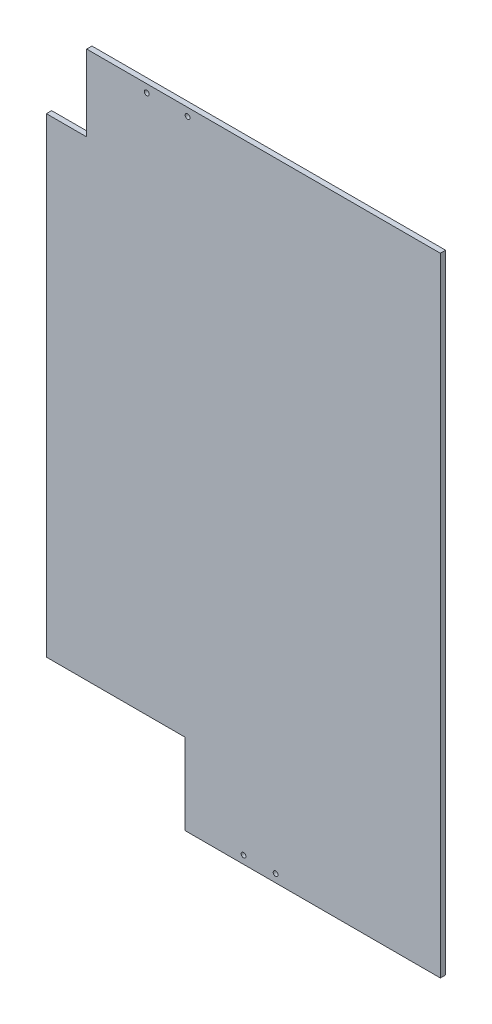
from build123d import *

# Parameters (mm, degrees)
BOSS_EXTRUDE1_DEPTH = 3.3
SKETCH2_R           = 1.5
CUT_EXTRUDE1_DEPTH  = 418.013500605
SKETCH5_W           = 31.32455923
SKETCH5_H           = 266
CUT_EXTRUDE4_DEPTH  = 10


with BuildPart() as part:
    # Sketch1 → Boss-Extrude1 (new body)
    with BuildSketch(Plane.XY):
        Polygon((-5.782297403, 1), (-5.782297403, -13), (25.5, -13), (25.5, -225), (-5.82455923, -225), (-5.82455923, -265), (112.438763187, -265), (112.438763187, -315.7), (272.438763187, -315.7), (272.438763187, 77.7), (50.748117859, 77.7), (50.748117859, 30), (25.5, 30), (25.5, 1), align=None)
    extrude(amount=BOSS_EXTRUDE1_DEPTH)

    # Sketch2 → Cut-Extrude1 (cut, through all)
    with BuildSketch(Plane(origin=(0, 0, 0), x_dir=(-1, 0, 0), z_dir=(0, 0, -1))):
        with Locations((-113.998383462, 72.7)):
            Circle(SKETCH2_R)
        with Locations((-88.397045893, 72.7)):
            Circle(SKETCH2_R)
        with Locations((-169.168895948, -310.7)):
            Circle(SKETCH2_R)
        with Locations((-149.084447974, -310.7)):
            Circle(SKETCH2_R)
    extrude(amount=-CUT_EXTRUDE1_DEPTH, mode=Mode.SUBTRACT)

    # Sketch5 → Cut-Extrude4 (cut)
    with BuildSketch(Plane(origin=(0, 0, 0), x_dir=(-1, 0, 0), z_dir=(0, 0, -1))):
        with Locations((-9.837720385, -132)):
            Rectangle(SKETCH5_W, SKETCH5_H)
    extrude(amount=-CUT_EXTRUDE4_DEPTH, mode=Mode.SUBTRACT)


solid = part.part
